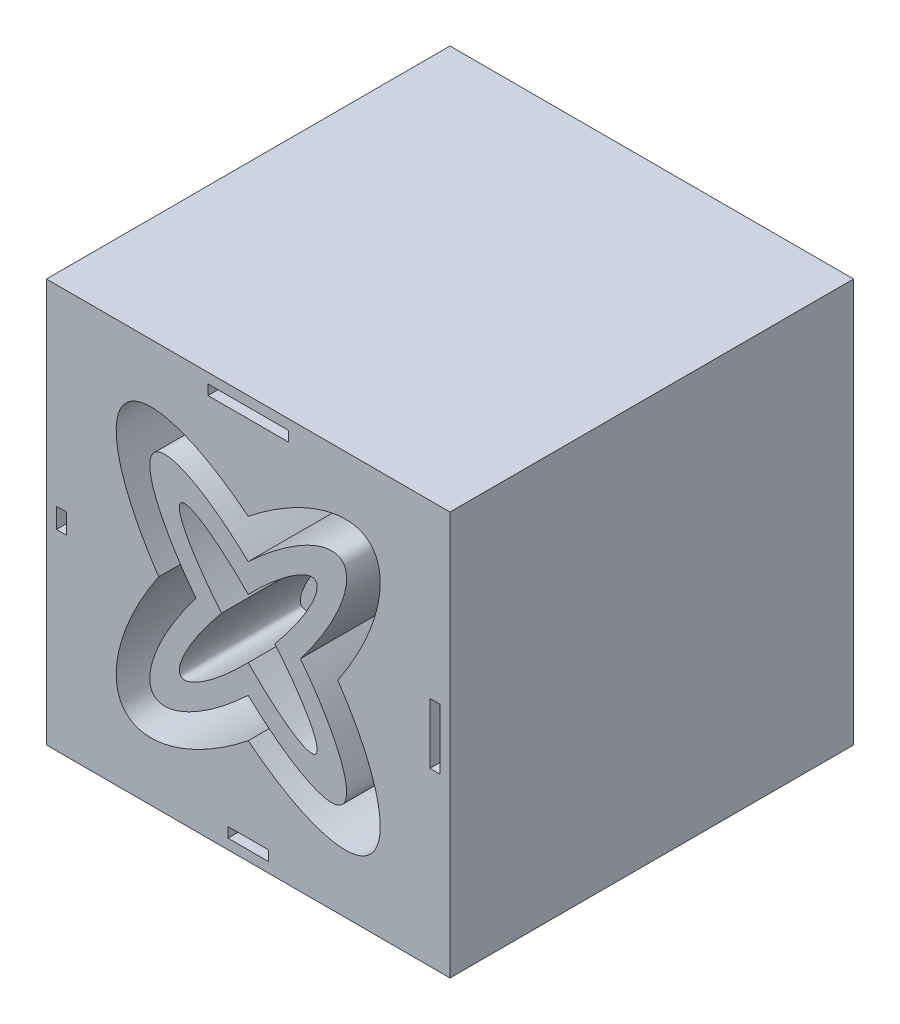
from build123d import *

# Parameters (mm, degrees)
BOSS_EXTRU_1_DEPTH      = 100
BOSS_EXTRU_1_DEPTH_BACK = 100
ESQUISSE1_W             = 200
ESQUISSE1_H             = 200
ESQUISSE2_W             = 20
ESQUISSE2_H             = 5
ESQUISSE2_W_2           = 5
ESQUISSE2_H_2           = 30
ESQUISSE2_W_3           = 40
ESQUISSE2_H_3           = 10
ENL_V_MAT_EXTRU_2_DEPTH = 60
ECHELLE1_SCALE          = 0.004


with BuildPart() as part:
    # Esquisse1 → Boss.-Extru.1 (new, two sides: drawn at the far end of the back side and taken through both)
    with BuildSketch(Plane.XY.offset(-BOSS_EXTRU_1_DEPTH_BACK)):
        Rectangle(ESQUISSE1_W, ESQUISSE1_H)
    extrude(amount=BOSS_EXTRU_1_DEPTH + BOSS_EXTRU_1_DEPTH_BACK)

    # Esquisse2 → Enlèv. mat.-Extru.2 (cut)
    # profile 1 of 6: a face of its own
    with BuildSketch(Plane.XY.offset(100)):
        with Locations((0, -92.5)):
            Rectangle(ESQUISSE2_W, ESQUISSE2_H)
    # profile 2 of 6: a face of its own
    with BuildSketch(Plane.XY.offset(100)):
        with Locations((92.5, 0)):
            Rectangle(ESQUISSE2_W_2, ESQUISSE2_H_2)
    # profile 3 of 6: a face of its own
    with BuildSketch(Plane.XY.offset(100)):
        with Locations((0, 92.5)):
            Rectangle(ESQUISSE2_W_3, ESQUISSE2_H)
    # profile 4 of 6: a face of its own
    with BuildSketch(Plane.XY.offset(100)):
        with Locations((-92.5, 0)):
            Rectangle(ESQUISSE2_W_2, ESQUISSE2_H_3)
    # profile 5 of 6: a face of its own
    with BuildSketch(Plane.XY.offset(100)):
        with BuildLine():
            add(Edge.make_bspline(
                [(44.351047547, 0), (78.546468568, 50.493573541), (60, 67.082039325)],
                knots=[5.047131803, 5.047131803, 5.047131803, 6.283185307, 6.283185307, 6.283185307], degree=2, weights=[1, 0.815023398, 1]))
            add(Edge.make_bspline(
                [(60, 67.082039325), (42.895976585, 82.380342943), (0, 48.1460303)],
                knots=[0, 0, 0, 1.160661933, 1.160661933, 1.160661933], degree=2, weights=[1, 0.836281227, 1]))
            add(Edge.make_bspline(
                [(0, 48.1460303), (-167.470598231, 181.800542326), (-44.351047547, 0)],
                knots=[1.980930721, 1.980930721, 1.980930721, 4.377646158, 4.377646158, 4.377646158], degree=2, weights=[1, 0.363887936, 1]))
            add(Edge.make_bspline(
                [(-44.351047547, 0), (-167.470598231, -181.800542326), (0, -48.1460303)],
                knots=[1.90553915, 1.90553915, 1.90553915, 4.302254586, 4.302254586, 4.302254586], degree=2, weights=[1, 0.363887936, 1]))
            add(Edge.make_bspline(
                [(0, -48.1460303), (42.895976585, -82.380342943), (60, -67.082039325)],
                knots=[5.122523374, 5.122523374, 5.122523374, 6.283185307, 6.283185307, 6.283185307], degree=2, weights=[1, 0.836281227, 1]))
            add(Edge.make_bspline(
                [(60, -67.082039325), (78.546468568, -50.493573541), (44.351047547, 0)],
                knots=[0, 0, 0, 1.236053504, 1.236053504, 1.236053504], degree=2, weights=[1, 0.815023398, 1]))
        make_face()
        with BuildLine():
            add(Edge.make_bspline(
                [(34.963798186, 12.790653527), (55.451983981, 44.389377301), (46.444423692, 52.376722227)],
                knots=[5.199511364, 5.199511364, 5.199511364, 6.283185307, 6.283185307, 6.283185307], degree=2, weights=[1, 0.856762781, 1]))
            add(Edge.make_bspline(
                [(25.904343593, -0.010581385), (30.873554366, 6.482311445), (34.963798186, 12.790653527)],
                knots=[4.960320969, 4.960320969, 4.960320969, 5.199511364, 5.199511364, 5.199511364], degree=2, weights=[1, 0.992857014, 1]))
            add(Edge.make_bspline(
                [(34.947788151, -12.810877359), (30.864821234, -6.503174511), (25.904343593, -0.010581385)],
                knots=[1.08384718, 1.08384718, 1.08384718, 1.322872375, 1.322872375, 1.322872375], degree=2, weights=[1, 0.992866866, 1]))
            add(Edge.make_bspline(
                [(46.401774484, -52.416151598), (55.417806713, -44.434644344), (34.947788151, -12.810877359)],
                knots=[0, 0, 0, 1.08384718, 1.08384718, 1.08384718], degree=2, weights=[1, 0.856718108, 1]))
            add(Edge.make_bspline(
                [(11.215237905, -38.482756231), (37.960842812, -59.888546956), (46.401774484, -52.416151598)],
                knots=[5.256667724, 5.256667724, 5.256667724, 6.283185307, 6.283185307, 6.283185307], degree=2, weights=[1, 0.871149008, 1]))
            add(Edge.make_bspline(
                [(-0.012056803, -28.704168287), (5.6778729, -34.050937364), (11.215237905, -38.482756231)],
                knots=[5.02432639, 5.02432639, 5.02432639, 5.256667724, 5.256667724, 5.256667724], degree=2, weights=[1, 0.993259773, 1]))
            add(Edge.make_bspline(
                [(-11.235615159, -38.46388206), (-5.70025818, -34.040397845), (-0.012056803, -28.704168287)],
                knots=[4.168346861, 4.168346861, 4.168346861, 4.400442895, 4.400442895, 4.400442895], degree=2, weights=[1, 0.993273982, 1]))
            add(Edge.make_bspline(
                [(-34.963798186, -12.790653527), (-95.025359829, -105.422998569), (-11.235615159, -38.46388206)],
                knots=[2.05791871, 2.05791871, 2.05791871, 4.168346861, 4.168346861, 4.168346861], degree=2, weights=[1, 0.493041495, 1]))
            add(Edge.make_bspline(
                [(-25.904343593, 0.010581385), (-30.873554366, -6.482311445), (-34.963798186, -12.790653527)],
                knots=[1.818728315, 1.818728315, 1.818728315, 2.05791871, 2.05791871, 2.05791871], degree=2, weights=[1, 0.992857014, 1]))
            add(Edge.make_bspline(
                [(-34.947788151, 12.810877359), (-30.864821234, 6.503174511), (-25.904343593, 0.010581385)],
                knots=[4.225439834, 4.225439834, 4.225439834, 4.464465029, 4.464465029, 4.464465029], degree=2, weights=[1, 0.992866866, 1]))
            add(Edge.make_bspline(
                [(-11.215237905, 38.482756231), (-94.939897106, 105.491617671), (-34.947788151, 12.810877359)],
                knots=[2.115075071, 2.115075071, 2.115075071, 4.225439834, 4.225439834, 4.225439834], degree=2, weights=[1, 0.493069068, 1]))
            add(Edge.make_bspline(
                [(0.012056803, 28.704168287), (-5.6778729, 34.050937364), (-11.215237905, 38.482756231)],
                knots=[1.882733737, 1.882733737, 1.882733737, 2.115075071, 2.115075071, 2.115075071], degree=2, weights=[1, 0.993259773, 1]))
            add(Edge.make_bspline(
                [(11.235615159, 38.46388206), (5.70025818, 34.040397845), (0.012056803, 28.704168287)],
                knots=[1.026754208, 1.026754208, 1.026754208, 1.258850242, 1.258850242, 1.258850242], degree=2, weights=[1, 0.993273982, 1]))
            add(Edge.make_bspline(
                [(46.444423692, 52.376722227), (38.007437164, 59.858117784), (11.235615159, 38.46388206)],
                knots=[0, 0, 0, 1.026754208, 1.026754208, 1.026754208], degree=2, weights=[1, 0.871090909, 1]))
        make_face(mode=Mode.SUBTRACT)
    # profile 6 of 6: a face of its own
    with BuildSketch(Plane.XY.offset(100)):
        with BuildLine():
            add(Edge.make_bspline(
                [(-7.175653735, 21.648232182), (-13.332416809, 27.374863299), (-18.612839117, 31.302142581)],
                knots=[5.143999994, 5.143999994, 5.143999994, 5.508590295, 5.508590295, 5.508590295], degree=2, weights=[1, 0.983430202, 1]))
            add(Edge.make_bspline(
                [(-18.612839117, 31.302142581), (-30.297014822, 39.992171236), (-33.337584051, 37.272607484)],
                knots=[5.508590295, 5.508590295, 5.508590295, 6.283185307, 6.283185307, 6.283185307], degree=2, weights=[1, 0.925933138, 1]))
            add(Edge.make_bspline(
                [(-33.337584051, 37.272607484), (-36.545170088, 34.40365958), (-28.333577614, 20.784685634)],
                knots=[0, 0, 0, 0.812710828, 0.812710828, 0.812710828], degree=2, weights=[1, 0.918567495, 1]))
            add(Edge.make_bspline(
                [(-28.333577614, 20.784685634), (-24.769964796, 14.874413017), (-19.537000987, 7.961691819)],
                knots=[0.812710828, 0.812710828, 0.812710828, 1.181939924, 1.181939924, 1.181939924], degree=2, weights=[1, 0.98300708, 1]))
            add(Edge.make_bspline(
                [(-19.537000987, 7.961691819), (-16.557240721, 4.025442169), (-13.207242339, -0.000820796)],
                knots=[1.181939924, 1.181939924, 1.181939924, 1.39381223, 1.39381223, 1.39381223], degree=2, weights=[1, 0.994394011, 1]))
            add(Edge.make_bspline(
                [(-13.207242339, -0.000820796), (-16.554757633, -4.02487595), (-19.532518746, -7.959034608)],
                knots=[4.889386694, 4.889386694, 4.889386694, 5.101135905, 5.101135905, 5.101135905], degree=2, weights=[1, 0.994400517, 1]))
            add(Edge.make_bspline(
                [(-19.532518746, -7.959034608), (-24.767080091, -14.874832768), (-28.331223599, -20.787396561)],
                knots=[5.101135905, 5.101135905, 5.101135905, 5.470506082, 5.470506082, 5.470506082], degree=2, weights=[1, 0.982994129, 1]))
            add(Edge.make_bspline(
                [(-28.331223599, -20.787396561), (-36.540472337, -34.405733401), (-33.332848981, -37.274185731)],
                knots=[5.470506082, 5.470506082, 5.470506082, 6.283185307, 6.283185307, 6.283185307], degree=2, weights=[1, 0.91857374, 1]))
            add(Edge.make_bspline(
                [(-33.332848981, -37.274185731), (-30.292388556, -39.993150779), (-18.610989061, -31.30402305)],
                knots=[0, 0, 0, 0.774531408, 0.774531408, 0.774531408], degree=2, weights=[1, 0.925945149, 1]))
            add(Edge.make_bspline(
                [(-18.610989061, -31.30402305), (-13.333864533, -27.378670689), (-7.181114109, -21.655379483)],
                knots=[0.774531408, 0.774531408, 0.774531408, 1.138951297, 1.138951297, 1.138951297], degree=2, weights=[1, 0.983445645, 1]))
            add(Edge.make_bspline(
                [(-7.181114109, -21.655379483), (-3.630901941, -18.35297053), (0.000474515, -14.64030379)],
                knots=[1.138951297, 1.138951297, 1.138951297, 1.350788667, 1.350788667, 1.350788667], degree=2, weights=[1, 0.994395858, 1]))
            add(Edge.make_bspline(
                [(0.000474515, -14.64030379), (3.628536023, -18.348927918), (7.175653735, -21.648232182)],
                knots=[1.790789772, 1.790789772, 1.790789772, 2.00240734, 2.00240734, 2.00240734], degree=2, weights=[1, 0.994407471, 1]))
            add(Edge.make_bspline(
                [(7.175653735, -21.648232182), (13.332416809, -27.374863299), (18.612839117, -31.302142581)],
                knots=[2.00240734, 2.00240734, 2.00240734, 2.366997642, 2.366997642, 2.366997642], degree=2, weights=[1, 0.983430202, 1]))
            add(Edge.make_bspline(
                [(18.612839117, -31.302142581), (47.73445351, -52.961151308), (28.333577614, -20.784685634)],
                knots=[2.366997642, 2.366997642, 2.366997642, 3.954303481, 3.954303481, 3.954303481], degree=2, weights=[1, 0.701245762, 1]))
            add(Edge.make_bspline(
                [(28.333577614, -20.784685634), (24.769964796, -14.874413017), (19.537000987, -7.961691819)],
                knots=[3.954303481, 3.954303481, 3.954303481, 4.323532577, 4.323532577, 4.323532577], degree=2, weights=[1, 0.98300708, 1]))
            add(Edge.make_bspline(
                [(19.537000987, -7.961691819), (16.557240721, -4.025442169), (13.207242339, 0.000820796)],
                knots=[4.323532577, 4.323532577, 4.323532577, 4.535404884, 4.535404884, 4.535404884], degree=2, weights=[1, 0.994394011, 1]))
            add(Edge.make_bspline(
                [(13.207242339, 0.000820796), (16.554757633, 4.02487595), (19.532518746, 7.959034608)],
                knots=[1.747794041, 1.747794041, 1.747794041, 1.959543251, 1.959543251, 1.959543251], degree=2, weights=[1, 0.994400517, 1]))
            add(Edge.make_bspline(
                [(19.532518746, 7.959034608), (24.767080091, 14.874832768), (28.331223599, 20.787396561)],
                knots=[1.959543251, 1.959543251, 1.959543251, 2.328913428, 2.328913428, 2.328913428], degree=2, weights=[1, 0.982994129, 1]))
            add(Edge.make_bspline(
                [(28.331223599, 20.787396561), (47.725559456, 52.960693645), (18.610989061, 31.30402305)],
                knots=[2.328913428, 2.328913428, 2.328913428, 3.916124062, 3.916124062, 3.916124062], degree=2, weights=[1, 0.701279698, 1]))
            add(Edge.make_bspline(
                [(18.610989061, 31.30402305), (13.333864533, 27.378670689), (7.181114109, 21.655379483)],
                knots=[3.916124062, 3.916124062, 3.916124062, 4.280543951, 4.280543951, 4.280543951], degree=2, weights=[1, 0.983445645, 1]))
            add(Edge.make_bspline(
                [(7.181114109, 21.655379483), (3.630901941, 18.35297053), (-0.000474515, 14.64030379)],
                knots=[4.280543951, 4.280543951, 4.280543951, 4.492381321, 4.492381321, 4.492381321], degree=2, weights=[1, 0.994395858, 1]))
            add(Edge.make_bspline(
                [(-0.000474515, 14.64030379), (-3.628536023, 18.348927918), (-7.175653735, 21.648232182)],
                knots=[4.932382425, 4.932382425, 4.932382425, 5.143999994, 5.143999994, 5.143999994], degree=2, weights=[1, 0.994407471, 1]))
        make_face()
    enl_v_mat_extru_2 = extrude(amount=-ENL_V_MAT_EXTRU_2_DEPTH, mode=Mode.SUBTRACT)

    # Symétrie2: Enlèv. mat.-Extru.2 across plane
    add(enl_v_mat_extru_2.mirror(Plane.XY), mode=Mode.SUBTRACT)


with BuildPart() as part_1:
    # Echelle1: scaled about (-0.166506621, -0.166511753, 0)
    add(part.part.scale(ECHELLE1_SCALE).moved(Location((-0.165840595, -0.165845706, 0))))


solid = part_1.part
